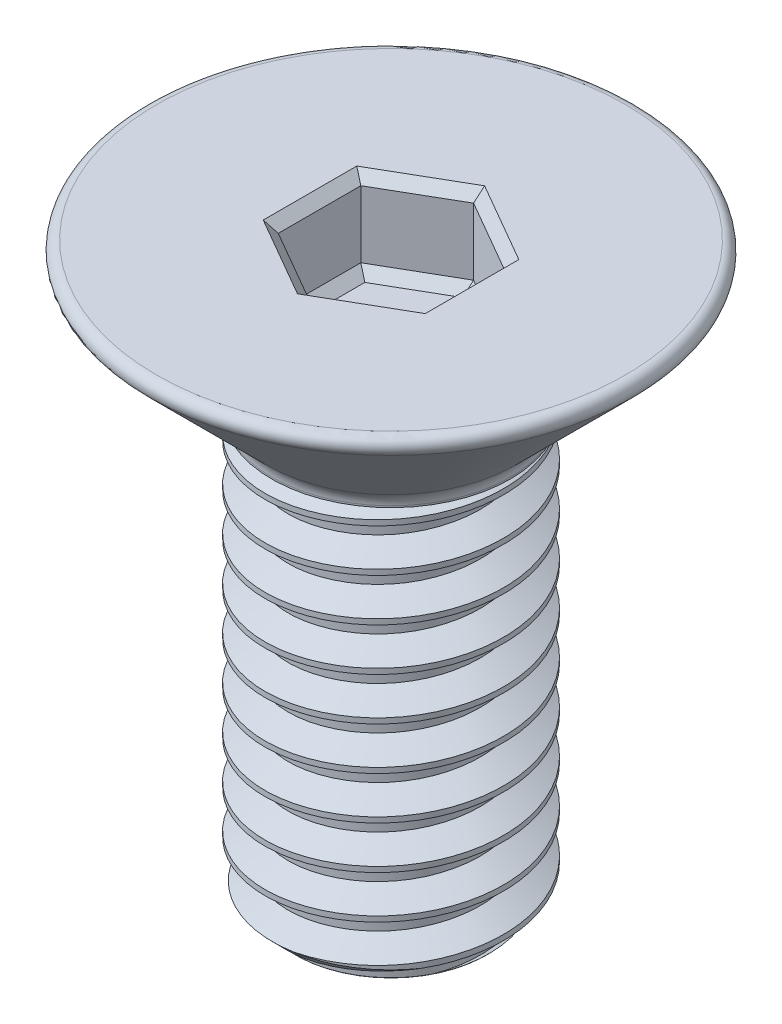
from build123d import *

# Parameters (mm, degrees)
SKETCH1_R           = 1.25
BOSS_EXTRUDE1_DEPTH = 4.45
THREAD1_PITCH       = 0.45
SKETCH5_R           = 1.25
BOSS_EXTRUDE2_DEPTH = 0.1
SKETCH6_R           = 1.25
BOSS_EXTRUDE3_DEPTH = 1.45
BOSS_EXTRUDE3_DRAFT = -45
FILLET1_R           = 0.2
FILLET2_R           = 0.1
CUT_EXTRUDE1_DEPTH  = 0.8
CHAMFER1_SIZE       = 0.1
CUT_EXTRUDE2_DEPTH  = 0.1
CUT_EXTRUDE2_DRAFT  = -45


with BuildPart() as part:
    # Sketch1 → Boss-Extrude1 (new body)
    with BuildSketch(Plane(origin=(0, 0, 0), x_dir=(1, 0, 0), z_dir=(0, 1, 0))):
        with Locations(Location((0, 0, 0), (0, 0, 270))):
            Circle(SKETCH1_R)
    extrude(amount=BOSS_EXTRUDE1_DEPTH)

    # Thread1: the profile of Thread Profile1 profile screwed along a right-hand helix of 12.111111 turns, 6 arcs to a turn; built about Z, then put on its axis
    thread1_z = Axis((0, 0, 0), (0, 0, 1))
    thread1_corners = [(1.2503, 0, -0.000173205), (1.2503, 0, 0.393923204), (1.006430356, 0, 0.253124999), (1.006430356, 0, 0.140624999)]
    with BuildLine(mode=Mode.PRIVATE) as thread1_profile:
        Line(thread1_corners[0], thread1_corners[1])
        Line(thread1_corners[1], thread1_corners[2])
        Line(thread1_corners[2], thread1_corners[3])
        Line(thread1_corners[3], thread1_corners[0])
    thread1_cap = Face(thread1_profile.wire())
    thread1_turn_angles = [0, 30, 60, 90, 120, 150, 180, 210, 240, 270, 300, 330, 360]
    thread1_turn_weights = [1, 0.8660254037844387, 1, 0.8660254037844387, 1, 0.8660254037844387, 1, 0.8660254037844387, 1, 0.8660254037844387, 1, 0.8660254037844387, 1]
    thread1_turn_rails = [Edge.make_bspline([Vector(p[0], p[1], 0).rotate(thread1_z, thread1_turn_angles[k]) / thread1_turn_weights[k] + Vector(0, 0, p[2] + THREAD1_PITCH * thread1_turn_angles[k] / 360) for k in range(13)], [0, 0, 0, 1, 1, 2, 2, 3, 3, 4, 4, 5, 5, 6, 6, 6], 2, thread1_turn_weights) for p in thread1_corners]
    thread1_turn_sides = [Face.make_surface_from_curves(thread1_turn_rails[p[0]], thread1_turn_rails[p[1]]) for p in [(0, 1), (1, 2), (2, 3), (3, 0)]]
    thread1_last_angles = [4320, 4340, 4360]
    thread1_last_weights = [1, 0.9396926207859084, 1]
    thread1_last_rails = [Edge.make_bspline([Vector(p[0], p[1], 0).rotate(thread1_z, thread1_last_angles[k]) / thread1_last_weights[k] + Vector(0, 0, p[2] + THREAD1_PITCH * thread1_last_angles[k] / 360) for k in range(3)], [0, 0, 0, 1, 1, 1], 2, thread1_last_weights) for p in thread1_corners]
    thread1_last_sides = [Face.make_surface_from_curves(thread1_last_rails[p[0]], thread1_last_rails[p[1]]) for p in [(0, 1), (1, 2), (2, 3), (3, 0)]]
    thread1 = Plane(origin=(0, -1, 0), x_dir=(1, 0, 0), z_dir=(0, 1, 0)) * Solid(Shell([*[p.moved(Location((0, 0, THREAD1_PITCH * i))) for i in range(12) for p in thread1_turn_sides], *thread1_last_sides, thread1_cap, thread1_cap.rotate(thread1_z, 4360).moved(Location((0, 0, THREAD1_PITCH * 4360 / 360)))]))
    add(thread1, mode=Mode.SUBTRACT)

    # Sketch5 → Boss-Extrude2 (add)
    with BuildSketch(Plane(origin=(0, 4.45, 0), x_dir=(1, 0, 0), z_dir=(0, 1, 0))):
        with Locations(Location((0, 0, 0), (0, 0, 85.219809095))):
            Circle(SKETCH5_R)
    extrude(amount=BOSS_EXTRUDE2_DEPTH)


with BuildPart() as boss_extrude3_tool:
    # Sketch6 → Boss-Extrude3 (with draft: the straight prism first)
    with BuildSketch(Plane(origin=(0, 4.55, 0), x_dir=(1, 0, 0), z_dir=(0, 1, 0))):
        with Locations(Location((0, 0, 0), (0, 0, 85.219809095))):
            Circle(SKETCH6_R)
    extrude(amount=BOSS_EXTRUDE3_DEPTH)
    # Boss-Extrude3: the draft: its side faces are tilted about the plane it starts from
    boss_extrude3_sides = [boss_extrude3_tool.faces().sort_by_distance(p)[0] for p in [
        (-0.104166646, 5.275, 1.245652162),
    ]]
    draft(boss_extrude3_sides, Plane(origin=(0, 4.55, 0), x_dir=(1, 0, 0), z_dir=(0, 1, 0)), BOSS_EXTRUDE3_DRAFT)


with BuildPart() as part_1:
    add(part.part)

    # Boss-Extrude3: add boss_extrude3_tool
    add(boss_extrude3_tool.part)

    # Fillet1
    fillet1_edges = [part_1.edges().sort_by_distance(p)[0] for p in [
        (-0.104166646, 4.55, 1.245652162),
    ]]
    fillet(fillet1_edges, radius=FILLET1_R)

    # Fillet2
    fillet2_edges = [part_1.edges().sort_by_distance(p)[0] for p in [
        (-0.224999956, 6, 2.690608671),
    ]]
    fillet(fillet2_edges, radius=FILLET2_R)

    # Sketch7 → Cut-Revolve1 (revolve, cut)
    with BuildSketch(Plane.XY, mode=Mode.PRIVATE) as cut_revolve1_sk:
        Polygon((1.26, 0), (1.26, 0.26), (1, 0), align=None)
    revolve(cut_revolve1_sk.sketch.rotate(Axis((0, 0, 0), (0, 1, 0)), 85.219809095), axis=Axis((0, 0, 0), (0, 1, 0)), mode=Mode.SUBTRACT)

    # Sketch8 → Cut-Extrude1 (cut)
    with BuildSketch(Plane(origin=(0, 6, 0), x_dir=(1, 0, 0), z_dir=(0, 1, 0))):
        Polygon((0, 0.866025404), (-0.75, 0.433012702), (-0.75, -0.433012702), (0, -0.866025404), (0.75, -0.433012702), (0.75, 0.433012702), align=None)
    extrude(amount=-CUT_EXTRUDE1_DEPTH, mode=Mode.SUBTRACT)

    # Chamfer1
    chamfer1_edges = [part_1.edges().sort_by_distance(p)[0] for p in [
        (0.375, 6, -0.649519053),
        (-0.375, 6, -0.649519053),
        (-0.75, 6, 0),
        (-0.375, 6, 0.649519053),
        (0.375, 6, 0.649519053),
        (0.75, 6, 0),
    ]]
    chamfer(chamfer1_edges, length=CHAMFER1_SIZE)


with BuildPart() as cut_extrude2_tool:
    # Sketch9 → Cut-Extrude2 (with draft: the straight prism first)
    with BuildSketch(Plane(origin=(0, 5.2, 0), x_dir=(1, 0, 0), z_dir=(0, 1, 0))):
        Polygon((0, 0.866025404), (-0.75, 0.433012702), (-0.75, -0.433012702), (0, -0.866025404), (0.75, -0.433012702), (0.75, 0.433012702), align=None)
    extrude(amount=-CUT_EXTRUDE2_DEPTH)
    # Cut-Extrude2: the draft: its side faces are tilted about the plane it starts from
    cut_extrude2_sides = [cut_extrude2_tool.faces().sort_by_distance(p)[0] for p in [
        (-0.375, 5.15, -0.649519053),
        (-0.75, 5.15, 0),
        (-0.375, 5.15, 0.649519053),
        (0.375, 5.15, 0.649519053),
        (0.75, 5.15, 0),
        (0.375, 5.15, -0.649519053),
    ]]
    draft(cut_extrude2_sides, Plane(origin=(0, 5.2, 0), x_dir=(1, 0, 0), z_dir=(0, 1, 0)), CUT_EXTRUDE2_DRAFT)


with BuildPart() as part_2:
    add(part_1.part)

    # Cut-Extrude2: cut by cut_extrude2_tool
    add(cut_extrude2_tool.part, mode=Mode.SUBTRACT)


solid = part_2.part
